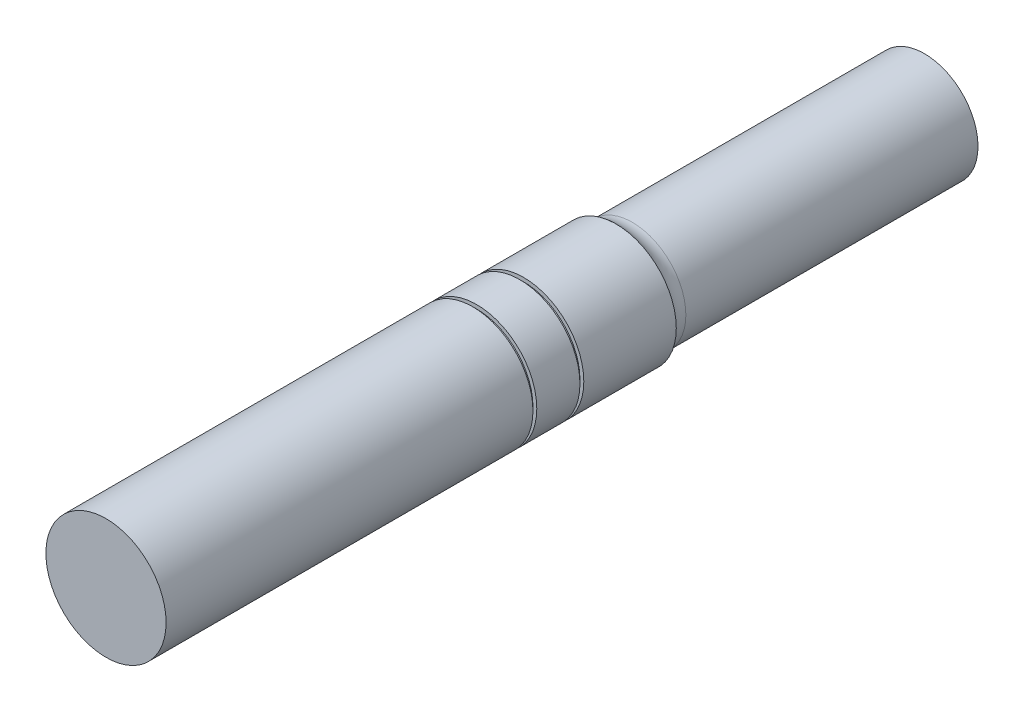
from build123d import *

# Parameters (mm, degrees)
REDONDEO1_R                      = 0.762
TALADRO_DE_MARGEN_PARA_101_D     = 1.9304
TALADRO_DE_MARGEN_PARA_101_DEPTH = 0.9906
TALADRO_DE_MARGEN_PARA_101_TIP   = 0.579950669
CHAFL_N1_SIZE                    = 0.79375
CHAFL_N1_SIZE2                   = 0.458271776


with BuildPart() as part:
    # Croquis1 → Revolución1 (revolve)
    with BuildSketch(Plane(origin=(0, 0, 0), x_dir=(0, 0, -1), z_dir=(1, 0, 0)), mode=Mode.PRIVATE) as revoluci_n1_sk:
        Polygon((-13.4874, 0), (-13.4874, 1.9812), (-1.397, 1.9812), (-1.397, 1.8542), (-1.27, 1.8542), (-1.27, 1.9812), (0.1524, 1.9812), (0.1524, 1.8542), (0.2794, 1.8542), (0.2794, 1.9812), (3.3274, 1.9812), (3.3274, 1.7653), (13.4874, 1.7653), (13.4874, 0), align=None)
    revolve(revoluci_n1_sk.sketch.rotate(Axis((0, 0, 127), (0, 0, -1)), 90), axis=Axis((0, 0, 127), (0, 0, -1)))

    # Redondeo1
    # the kernel refuses this fillet: 0.762 mm, written as the material it adds along each edge
    with BuildSketch(Plane(origin=(0, 0, -3.3274), x_dir=(1, 0, 0), z_dir=(0, 1, 0))) as redondeo1_piece_1:
        with BuildLine():
            CenterArc((2.5273, 0.531430889), REDONDEO1_R, 180, 44.220044428)
            Line((1.7653, 0.531430889), (1.75006, 0.531430889))
            Line((1.75006, 0.531430889), (1.75006, 0))
            Line((1.75006, 0), (1.7653, -0.01524))
            ThreePointArc((1.7653, -0.01524), (1.87325, -0.01524), (1.970278, -0.010628618))
            Line((1.970278, -0.010628618), (1.9812, 0))
        make_face()
    revolve(axis=Axis((0, 0, -3.3274), (0, 0, -1)))

    # Taladro de margen para #101
    with Locations(Plane(origin=(0, 0, -13.4874), x_dir=(-1, 0, 0), z_dir=(0, 0, -1))):
        with Locations((0, 0)):
            Hole(TALADRO_DE_MARGEN_PARA_101_D / 2, depth=TALADRO_DE_MARGEN_PARA_101_DEPTH)
            with Locations((0, 0, -(TALADRO_DE_MARGEN_PARA_101_DEPTH + TALADRO_DE_MARGEN_PARA_101_TIP / 2))):  # 118° drill point
                Cone(0, TALADRO_DE_MARGEN_PARA_101_D / 2, TALADRO_DE_MARGEN_PARA_101_TIP, mode=Mode.SUBTRACT)

    # Chaflán1
    chafl_n1_edges = [part.edges().sort_by_distance(p)[0] for p in [
        (-0.9652, 0, -13.4874),
    ]]
    chafl_n1_side = [part.faces().sort_by_distance(p)[0] for p in [
        (-1.715369776, 0, -13.4874),
    ]]
    chamfer(chafl_n1_edges, length=CHAFL_N1_SIZE, length2=CHAFL_N1_SIZE2, reference=chafl_n1_side[0])


solid = part.part
